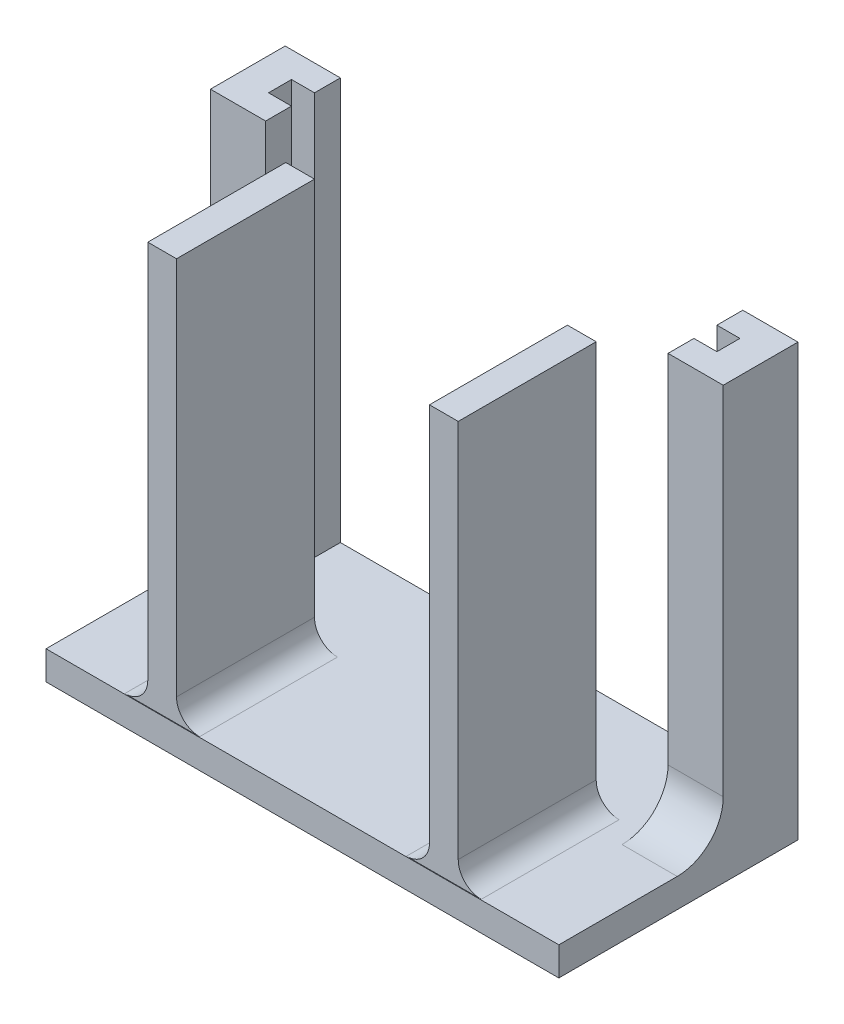
from build123d import *

# Parameters (mm, degrees)
BOSS_EXTRUDE1_DEPTH   = 35
BOSS_EXTRUDE1_2_DEPTH = 35
SKETCH1_W             = 2.5
SKETCH1_H             = 12
BOSS_EXTRUDE1_3_DEPTH = 35
BOSS_EXTRUDE1_4_DEPTH = 35
SKETCH2_W             = 44.6
SKETCH2_H             = 20.8
BOSS_EXTRUDE2_DEPTH   = 2.5
FILLET1_R             = 2
FILLET2_R             = 4


with BuildPart() as part:
    # Sketch1 → Boss-Extrude1 (new body)
    with BuildSketch(Plane(origin=(0, -19, 0), x_dir=(1, 0, 0), z_dir=(0, 1, 0))):
        Polygon((-19.5, 0.5), (-17.5, 0.5), (-17.5, 2.75), (-22.3, 2.75), (-22.3, -3.75), (-17.5, -3.75), (-17.5, -1.5), (-19.5, -1.5), align=None)
    extrude(amount=BOSS_EXTRUDE1_DEPTH)



with BuildPart() as body_2:
    # Sketch1 → Boss-Extrude1 2 (new body)
    with BuildSketch(Plane(origin=(0, -19, 0), x_dir=(1, 0, 0), z_dir=(0, 1, 0))):
        Polygon((19.5, -1.5), (19.5, 0.5), (17.5, 0.5), (17.5, 2.75), (22.3, 2.75), (22.3, -3.75), (17.5, -3.75), (17.5, -1.5), align=None)
    extrude(amount=BOSS_EXTRUDE1_2_DEPTH)


with BuildPart() as body_3:
    # Sketch1 → Boss-Extrude1 3 (new body)
    with BuildSketch(Plane(origin=(0, -19, 0), x_dir=(1, 0, 0), z_dir=(0, 1, 0))):
        with Locations((12.25, -12)):
            Rectangle(SKETCH1_W, SKETCH1_H)
    extrude(amount=BOSS_EXTRUDE1_3_DEPTH)


with BuildPart() as body_4:
    # Sketch1 → Boss-Extrude1 4 (new body)
    with BuildSketch(Plane(origin=(0, -19, 0), x_dir=(1, 0, 0), z_dir=(0, 1, 0))):
        with Locations((-12.25, -12)):
            Rectangle(SKETCH1_W, SKETCH1_H)
    extrude(amount=BOSS_EXTRUDE1_4_DEPTH)


with BuildPart() as part_1:
    add(part.part)

    add(body_2.part)  # Boss-Extrude2 merges body 2

    add(body_3.part)  # Boss-Extrude2 merges body 3

    add(body_4.part)  # Boss-Extrude2 merges body 4
    # Sketch2 → Boss-Extrude2 (add)
    with BuildSketch(Plane(origin=(0, -19, 0), x_dir=(1, 0, 0), z_dir=(0, 1, 0))):
        with Locations((0, -7.65)):
            Rectangle(SKETCH2_W, SKETCH2_H)
    extrude(amount=-BOSS_EXTRUDE2_DEPTH)

    # Fillet1
    fillet1_edges = [part_1.edges().sort_by_distance(p)[0] for p in [
        (-13.5, -19, 12),
        (11, -19, 12),
        (-11, -19, 12),
        (13.5, -19, 12),
    ]]
    fillet(fillet1_edges, radius=FILLET1_R)

    # Fillet2
    fillet2_edges = [part_1.edges().sort_by_distance(p)[0] for p in [
        (19.9, -19, 3.75),
        (-19.9, -19, 3.75),
    ]]
    fillet(fillet2_edges, radius=FILLET2_R)


solid = part_1.part
